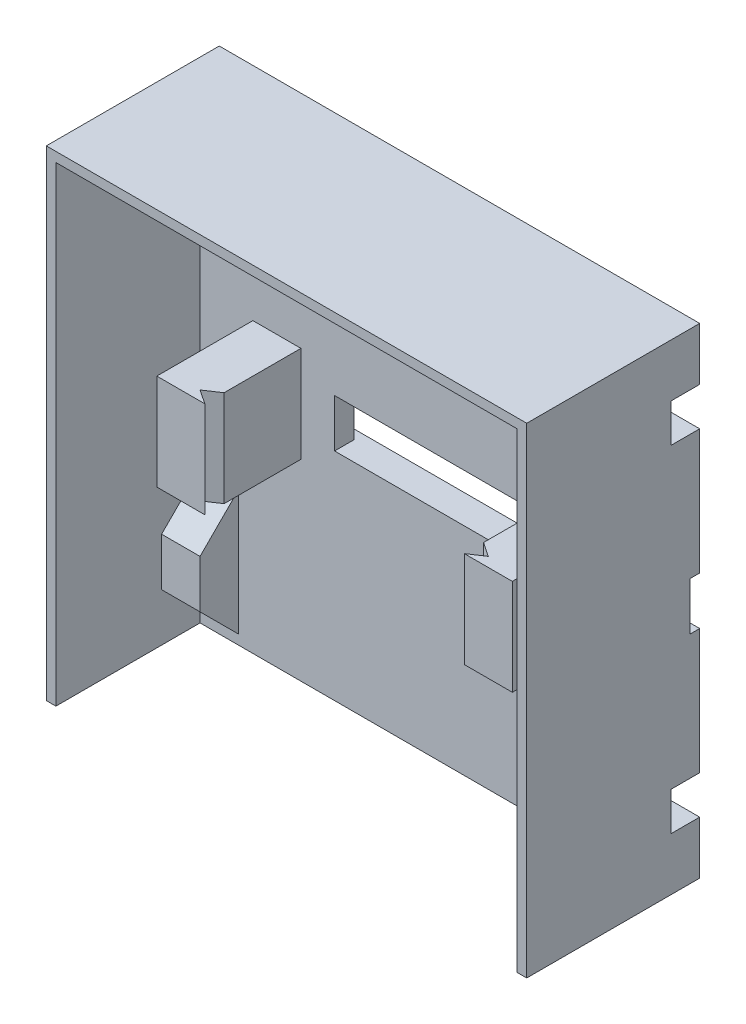
from build123d import *

# Parameters (mm, degrees)
SKICA1_W                  = 50
SKICA1_H                  = 50
P_IDAT_VYSUNUT_M2_DEPTH   = 3
SKICA4_W                  = 20
SKICA4_H                  = 5
ODEBRAT_VYSUNUT_M1_DEPTH  = 2
SKICA5_W                  = 50
SKICA5_H                  = 5
ODEBRAT_VYSUNUT_M3_DEPTH  = 1
SKICA10_W                 = 5
SKICA10_H                 = 10
P_IDAT_VYSUNUT_M6_DEPTH   = 10
ODEBRAT_VYSUNUT_M6_DEPTH  = 10
P_IDAT_VYSUNUT_M9_DEPTH   = 15
SKICA17_R                 = 2
ODEBRAT_VYSUNUT_M8_DEPTH  = 4
SKICA18_W                 = 5
SKICA18_H                 = 5
P_IDAT_VYSUNUT_M10_DEPTH  = 7
SKICA19_W                 = 4
SKICA19_H                 = 4
ODEBRAT_VYSUNUT_M10_DEPTH = 3
ZKOSEN_2_SIZE             = 4
SKICA20_R                 = 1.25
ODEBRAT_VYSUNUT_M11_DEPTH = 3


with BuildPart() as part:
    # Skica1 → Přidat vysunutím2 (new body)
    with BuildSketch(Plane.XY):
        Rectangle(SKICA1_W, SKICA1_H)
    extrude(amount=P_IDAT_VYSUNUT_M2_DEPTH)

    # Skica4 → Odebrat vysunutím1 (cut)
    with BuildSketch(Plane.XY.offset(3)):
        Rectangle(SKICA4_W, SKICA4_H)
    extrude(amount=-ODEBRAT_VYSUNUT_M1_DEPTH, mode=Mode.SUBTRACT)

    # Skica5 → Odebrat vysunutím3 (cut)
    with BuildSketch(Plane(origin=(0, 0, 0), x_dir=(-1, 0, 0), z_dir=(0, 0, -1))):
        Rectangle(SKICA5_W, SKICA5_H)
    extrude(amount=-ODEBRAT_VYSUNUT_M3_DEPTH, mode=Mode.SUBTRACT)

    # Skica10 → Přidat vysunutím6 (add)
    with BuildSketch(Plane.XY.offset(3)):
        with Locations((-16, 0)):
            Rectangle(SKICA10_W, SKICA10_H)
        with Locations((16, 0)):
            Rectangle(SKICA10_W, SKICA10_H)
    extrude(amount=P_IDAT_VYSUNUT_M6_DEPTH)

    # Skica12 → Odebrat vysunutím6 (cut)
    with BuildSketch(Plane(origin=(0, 5, 0), x_dir=(1, 0, 0), z_dir=(0, 1, 0))):
        Polygon((-13.5, -13), (-13.5, -11), (-15, -12), align=None)
        Polygon((13.5, -13), (13.5, -11), (15, -12), align=None)
    extrude(amount=-ODEBRAT_VYSUNUT_M6_DEPTH, mode=Mode.SUBTRACT)

    # Skica14 → Přidat vysunutím9 (add)
    with BuildSketch(Plane.XY.offset(3)):
        Polygon((25, 25), (-25, 25), (-25, -25), (-24, -25), (-24, 24), (24, 24), (24, -25), (25, -25), align=None)
    extrude(amount=P_IDAT_VYSUNUT_M9_DEPTH)

    # Skica17 → Odebrat vysunutím8 (cut)
    with BuildSketch(Plane(origin=(0, 0, 1), x_dir=(-1, 0, 0), z_dir=(0, 0, -1))):
        with Locations((-16, 0)):
            Circle(SKICA17_R)
        with Locations((16, 0)):
            Circle(SKICA17_R)
    extrude(amount=-ODEBRAT_VYSUNUT_M8_DEPTH, mode=Mode.SUBTRACT)

    # Skica18 → Přidat vysunutím10 (add)
    with BuildSketch(Plane(origin=(0, 0, 0), x_dir=(-1, 0, 0), z_dir=(0, 0, -1))):
        with Locations((-22.5, 17.5)):
            Rectangle(SKICA18_W, SKICA18_H)
        with Locations((22.5, 17.5)):
            Rectangle(SKICA18_W, SKICA18_H)
        with Locations((22.5, -17.5)):
            Rectangle(SKICA18_W, SKICA18_H)
        with Locations((-22.5, -17.5)):
            Rectangle(SKICA18_W, SKICA18_H)
    extrude(amount=-P_IDAT_VYSUNUT_M10_DEPTH)

    # Skica19 → Odebrat vysunutím10 (cut)
    with BuildSketch(Plane(origin=(0, 0, 0), x_dir=(-1, 0, 0), z_dir=(0, 0, -1))):
        with Locations((-23, -17.5)):
            Rectangle(SKICA19_W, SKICA19_H)
        with Locations((-23, 17.5)):
            Rectangle(SKICA19_W, SKICA19_H)
        with Locations((23, 17.5)):
            Rectangle(SKICA19_W, SKICA19_H)
        with Locations((23, -17.5)):
            Rectangle(SKICA19_W, SKICA19_H)
    extrude(amount=-ODEBRAT_VYSUNUT_M10_DEPTH, mode=Mode.SUBTRACT)

    # Zkosení2
    zkosen_2_edges = [part.edges().sort_by_distance(p)[0] for p in [
        (22, 15, 3),
        (22, 20, 3),
        (-22, 20, 3),
        (-22, 15, 3),
        (-22, -15, 3),
        (-22, -20, 3),
        (22, -20, 3),
        (22, -15, 3),
    ]]
    chamfer(zkosen_2_edges, length=ZKOSEN_2_SIZE - 0.0001)  # a hair under: the kernel refuses the full size

    # Skica20 → Odebrat vysunutím11 (cut)
    with BuildSketch(Plane(origin=(0, 0, 3), x_dir=(-1, 0, 0), z_dir=(0, 0, -1))):
        with Locations((22.75, 17.5)):
            Circle(SKICA20_R)
        with Locations(Location((22.75, -17.5, 0), (0, 0, 180))):
            Circle(SKICA20_R)
        with Locations((-22.75, -17.5)):
            Circle(SKICA20_R)
        with Locations(Location((-22.75, 17.5, 0), (0, 0, 180))):
            Circle(SKICA20_R)
    extrude(amount=-ODEBRAT_VYSUNUT_M11_DEPTH, mode=Mode.SUBTRACT)


solid = part.part
